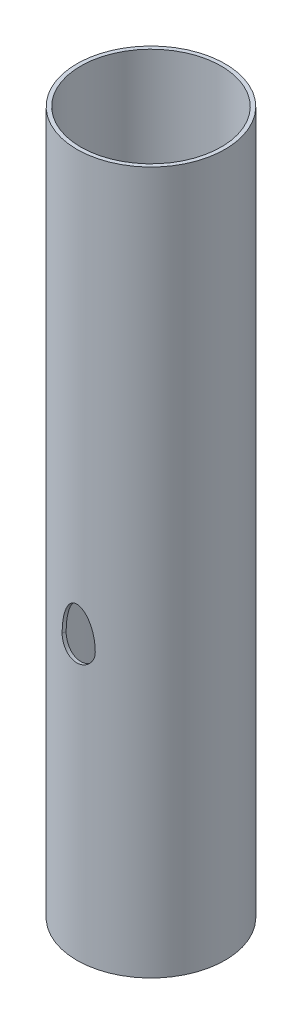
from build123d import *

# Parameters (mm, degrees)
SKETCH2_R           = 38
SKETCH2_R_2         = 36
BOSS_EXTRUDE1_DEPTH = 360
CUT_EXTRUDE1_REACH  = 365.989


with BuildPart() as part:
    # Sketch2 → Boss-Extrude1 (new body)
    with BuildSketch(Plane(origin=(0, 0, 0), x_dir=(1, 0, 0), z_dir=(0, 1, 0))):
        Circle(SKETCH2_R)
        Circle(SKETCH2_R_2, mode=Mode.SUBTRACT)
    extrude(amount=BOSS_EXTRUDE1_DEPTH)

    # Sketch3 → Cut-Extrude1 (cut, up to next)
    with BuildSketch(Plane(origin=(0, 0, 0), x_dir=(-1, 0, 0), z_dir=(0, 0.20449605184179045, 0.978867388761685)), mode=Mode.PRIVATE) as cut_extrude1_sk1:
        with BuildLine():
            ThreePointArc((8.5, -130), (0, -121.5), (-8.5, -130))
            add(Edge.make_bspline(
                [(-8.5, -130), (-8.5, -147), (0, -147), (8.5, -147), (8.5, -130)],
                knots=[4.71238898, 4.71238898, 4.71238898, 6.283185307, 6.283185307, 7.853981634, 7.853981634, 7.853981634], degree=2, weights=[1, 0.707106781, 1, 0.707106781, 1]))
        make_face()
    cut_extrude1_tool1 = extrude(cut_extrude1_sk1.sketch, amount=CUT_EXTRUDE1_REACH, mode=Mode.PRIVATE) & part.part
    add(cut_extrude1_tool1.solids().sort_by_distance((0, 130.782771, -27.321944))[0], mode=Mode.SUBTRACT)


solid = part.part
